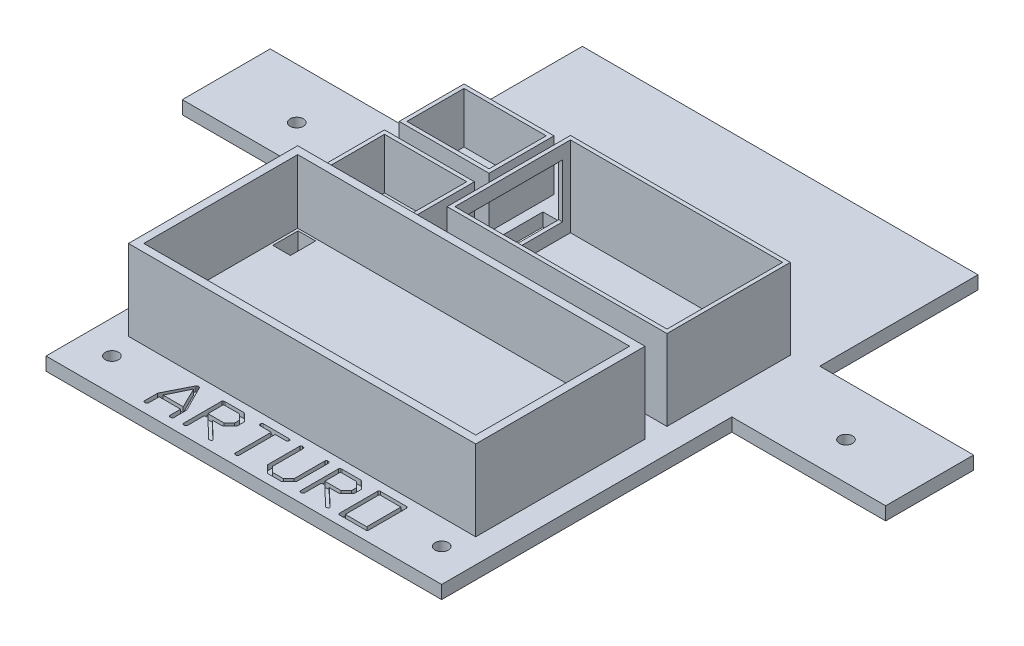
from build123d import *

# Parameters (mm, degrees)
SKETCH1_W           = 90
SKETCH1_H           = 145
BOSS_EXTRUDE1_DEPTH = 3
SKETCH3_W           = 35
SKETCH3_H           = 20
BOSS_EXTRUDE2_DEPTH = 3
SKETCH2_R           = 1.5
CUT_EXTRUDE1_DEPTH  = 3
SKETCH5_W           = 79
SKETCH5_H           = 38.5
BOSS_EXTRUDE3_DEPTH = 18.3
SKETCH7_W           = 75.5
SKETCH7_H           = 35
CUT_EXTRUDE3_DEPTH  = 14.5
SKETCH14_W          = 4
SKETCH14_H          = 5.732043078
CUT_EXTRUDE6_DEPTH  = 192.990234127
SKETCH8_W           = 20.45
SKETCH8_H           = 14.75
BOSS_EXTRUDE4_DEPTH = 11.55
SKETCH11_W          = 9.7
SKETCH11_H          = 8.5
CUT_EXTRUDE4_DEPTH  = 192.994016834
SKETCH12_W          = 9.7
SKETCH12_H          = 8.5
BOSS_EXTRUDE5_DEPTH = 11.55
SKETCH13_W          = 18.7
SKETCH13_H          = 13
CUT_EXTRUDE5_DEPTH  = 11.55
SKETCH19_W          = 50
SKETCH19_H          = 28.05
BOSS_EXTRUDE6_DEPTH = 18.3
SKETCH20_W          = 48.25
SKETCH20_H          = 26.3
CUT_EXTRUDE7_DEPTH  = 18.3
SKETCH22_W          = 22.713702628
SKETCH22_H          = 12.207325078
CUT_EXTRUDE8_DEPTH  = 1.75
SKETCH23_W          = 4.71681506
SKETCH23_H          = 27.232452361
CUT_EXTRUDE9_DEPTH  = 193.314560031
SKETCH24_W          = 4.877009242
SKETCH24_H          = 7.75887834
CUT_EXTRUDE10_DEPTH = 1.2
SKETCH25_R          = 1.5
CUT_EXTRUDE11_DEPTH = 193.314560172
SKETCH26_W          = 90
SKETCH26_H          = 23
CUT_EXTRUDE12_DEPTH = 193.314560172


with BuildPart() as part:
    # Sketch1 → Boss-Extrude1 (new body)
    with BuildSketch(Plane(origin=(0, 0, 0), x_dir=(1, 0, 0), z_dir=(0, 1, 0))):
        with Locations((45, 72.5)):
            Rectangle(SKETCH1_W, SKETCH1_H)
    extrude(amount=BOSS_EXTRUDE1_DEPTH)

    # Sketch3 → Boss-Extrude2 (add)
    with BuildSketch(Plane(origin=(0, 3, 0), x_dir=(1, 0, 0), z_dir=(0, 1, 0))):
        with Locations((107.5, 76)):
            Rectangle(SKETCH3_W, SKETCH3_H)
        with Locations((-17.5, 76)):
            Rectangle(SKETCH3_W, SKETCH3_H)
    extrude(amount=-BOSS_EXTRUDE2_DEPTH)

    # Sketch2 → Cut-Extrude1 (cut)
    with BuildSketch(Plane(origin=(0, 3, 0), x_dir=(1, 0, 0), z_dir=(0, 1, 0))):
        with Locations((7.5, 7.5)):
            Circle(SKETCH2_R)
        with Locations((82.5, 7.5)):
            Circle(SKETCH2_R)
    extrude(amount=-CUT_EXTRUDE1_DEPTH, mode=Mode.SUBTRACT)

    # Sketch5 → Boss-Extrude3 (add)
    with BuildSketch(Plane(origin=(0, 3, 0), x_dir=(1, 0, 0), z_dir=(0, 1, 0))):
        with Locations((45, 32.5)):
            Rectangle(SKETCH5_W, SKETCH5_H)
    extrude(amount=BOSS_EXTRUDE3_DEPTH)

    # Sketch7 → Cut-Extrude3 (cut)
    with BuildSketch(Plane(origin=(0, 21.3, 0), x_dir=(1, 0, 0), z_dir=(0, 1, 0))):
        with Locations((45, 32.5)):
            Rectangle(SKETCH7_W, SKETCH7_H)
    extrude(amount=-CUT_EXTRUDE3_DEPTH, mode=Mode.SUBTRACT)

    # Sketch14 → Cut-Extrude6 (cut, through all)
    with BuildSketch(Plane(origin=(0, 6.8, 0), x_dir=(1, 0, 0), z_dir=(0, 1, 0))):
        with Locations((9.802648825, 46.664015238)):
            Rectangle(SKETCH14_W, SKETCH14_H)
    extrude(amount=-CUT_EXTRUDE6_DEPTH, mode=Mode.SUBTRACT)

    # Sketch8 → Boss-Extrude4 (add)
    with BuildSketch(Plane(origin=(0, 3, 0), x_dir=(1, 0, 0), z_dir=(0, 1, 0))):
        with Locations((15.725, 64.125)):
            Rectangle(SKETCH8_W, SKETCH8_H)
        with Locations((15.725, 82.214128063)):
            Rectangle(SKETCH8_W, SKETCH8_H)
    extrude(amount=BOSS_EXTRUDE4_DEPTH)

    # Sketch11 → Cut-Extrude4 (cut, through all)
    with BuildSketch(Plane(origin=(0, 14.55, 0), x_dir=(1, 0, 0), z_dir=(0, 1, 0))):
        with Locations((19.625, 64.125)):
            Rectangle(SKETCH11_W, SKETCH11_H)
        with Locations((19.625, 82.214128063)):
            Rectangle(SKETCH11_W, SKETCH11_H)
    extrude(amount=-CUT_EXTRUDE4_DEPTH, mode=Mode.SUBTRACT)

    # Sketch12 → Boss-Extrude5 (add)
    with BuildSketch(Plane(origin=(0, 14.55, 0), x_dir=(1, 0, 0), z_dir=(0, 1, 0))):
        with Locations((19.625, 64.125)):
            Rectangle(SKETCH12_W, SKETCH12_H)
    extrude(amount=-BOSS_EXTRUDE5_DEPTH)

    # Sketch13 → Cut-Extrude5 (cut)
    with BuildSketch(Plane(origin=(0, 14.55, 0), x_dir=(1, 0, 0), z_dir=(0, 1, 0))):
        with Locations((15.725, 64.125)):
            Rectangle(SKETCH13_W, SKETCH13_H)
        with Locations((15.725, 82.214128063)):
            Rectangle(SKETCH13_W, SKETCH13_H)
    extrude(amount=-CUT_EXTRUDE5_DEPTH, mode=Mode.SUBTRACT)

    # Sketch19 → Boss-Extrude6 (add)
    with BuildSketch(Plane(origin=(0, 3, 0), x_dir=(1, 0, 0), z_dir=(0, 1, 0))):
        with Locations((59.5, 70.775)):
            Rectangle(SKETCH19_W, SKETCH19_H)
    extrude(amount=BOSS_EXTRUDE6_DEPTH)

    # Sketch20 → Cut-Extrude7 (cut)
    with BuildSketch(Plane(origin=(0, 21.3, 0), x_dir=(1, 0, 0), z_dir=(0, 1, 0))):
        with Locations((59.5, 70.775)):
            Rectangle(SKETCH20_W, SKETCH20_H)
    extrude(amount=-CUT_EXTRUDE7_DEPTH, mode=Mode.SUBTRACT)

    # Sketch22 → Cut-Extrude8 (cut)
    with BuildSketch(Plane.ZY.offset(-34.5)):
        with Locations((-70.775, 12.15)):
            Rectangle(SKETCH22_W, SKETCH22_H)
    extrude(amount=-CUT_EXTRUDE8_DEPTH, mode=Mode.SUBTRACT)

    # Sketch23 → Cut-Extrude9 (cut, through all)
    with BuildSketch(Plane(origin=(0, 3, 0), x_dir=(1, 0, 0), z_dir=(0, 1, 0))):
        with Locations((30.482199325, 71.298665432)):
            Rectangle(SKETCH23_W, SKETCH23_H)
    extrude(amount=-CUT_EXTRUDE9_DEPTH, mode=Mode.SUBTRACT)

    # Sketch24 → Cut-Extrude10 (cut)
    # profile 1 of 6: a face of its own
    with BuildSketch(Plane(origin=(0, 3, 0), x_dir=(1, 0, 0), z_dir=(0, 1, 0))):
        with BuildLine():
            Line((23.730328164, 11.141392021), (26.669349714, 5.334356513))
            Line((26.669349714, 5.334356513), (26.669349714, 2.386675501))
            add(Edge.make_bspline(
                [(26.669349714, 2.386675501), (26.662682685, 2.361570352), (26.649710289, 2.312721918), (26.616613779, 2.245534151), (26.570492881, 2.188690014), (26.511775677, 2.142919434), (26.440991913, 2.108059033), (26.35819529, 2.084804313), (26.264698822, 2.068766445), (26.198350998, 2.067131048), (26.163637108, 2.066275391)],
                knots=[0, 0, 0, 0, 0.947643866, 1.843881502, 2.713660738, 3.599912128, 4.543320166, 5.577847846, 6.732704141, 8, 8, 8, 8], degree=3))
            add(Edge.make_bspline(
                [(26.163637108, 2.066275391), (26.113937517, 2.070048438), (26.018408571, 2.077300715), (25.908602927, 2.129648138), (25.840486046, 2.195243361), (25.806488008, 2.264136158), (25.785617602, 2.347918769), (25.783672681, 2.409038929), (25.782620761, 2.44209606)],
                knots=[0, 0, 0, 0, 1.458306385, 2.803050631, 3.475744591, 4.205244022, 5.029297625, 6, 6, 6, 6], degree=3))
            Line((25.782620761, 2.44209606), (25.782620761, 4.837303369))
            Line((25.782620761, 4.837303369), (20.905611519, 4.837303369))
            Line((20.905611519, 4.837303369), (20.902147734, 2.357233328))
            add(Edge.make_bspline(
                [(20.902147734, 2.357233328), (20.894029138, 2.330923303), (20.877227743, 2.27647483), (20.816108463, 2.20872706), (20.737084205, 2.146464259), (20.672087968, 2.116832927), (20.637168183, 2.10091324)],
                knots=[0, 0, 0, 0, 0.85446616, 1.768313713, 2.801007444, 4, 4, 4, 4], degree=3))
            add(Edge.make_bspline(
                [(20.637168183, 2.10091324), (20.626394863, 2.095157835), (20.600446211, 2.081295347), (20.548952643, 2.074064899), (20.483311368, 2.066233222), (20.434018269, 2.066260399), (20.406826482, 2.066275391)],
                knots=[0, 0, 0, 0, 0.618990669, 1.490902888, 2.615894787, 4, 4, 4, 4], degree=3))
            add(Edge.make_bspline(
                [(20.406826482, 2.066275391), (20.379610123, 2.067160484), (20.327571154, 2.068852824), (20.253252524, 2.084813996), (20.186513326, 2.11108231), (20.12614444, 2.147142466), (20.075288668, 2.198297818), (20.042795851, 2.268509585), (20.021826278, 2.35311501), (20.019915072, 2.415383698), (20.018882565, 2.44902363)],
                knots=[0, 0, 0, 0, 1.042871789, 1.994020302, 2.898665572, 3.783582711, 4.676223712, 5.617005175, 6.71261484, 8, 8, 8, 8], degree=3))
            Line((20.018882565, 2.44902363), (20.018882565, 2.584111244))
            Line((20.018882565, 2.584111244), (20.018882565, 5.386313288))
            Line((20.018882565, 5.386313288), (22.952708438, 11.196812581))
            add(Edge.make_bspline(
                [(22.952708438, 11.196812581), (22.967632555, 11.215351287), (22.999113493, 11.254456842), (23.063987108, 11.303565216), (23.146261095, 11.343932556), (23.207610891, 11.365481602), (23.240202591, 11.376929399)],
                knots=[0, 0, 0, 0, 0.825089278, 1.740443647, 2.79962467, 4, 4, 4, 4], degree=3))
            add(Edge.make_bspline(
                [(23.240202591, 11.376929399), (23.298381001, 11.375163174), (23.40589449, 11.371899197), (23.549925192, 11.326436773), (23.666567863, 11.252879719), (23.709209409, 11.178319097), (23.730328164, 11.141392021)],
                knots=[0, 0, 0, 0, 1.208227024, 2.232799106, 3.124771774, 4, 4, 4, 4], degree=3))
        make_face()
        Polygon((21.03203967, 5.613191203), (25.595576373, 5.613191203), (23.300818828, 10.294496595), align=None, mode=Mode.SUBTRACT)
    # profile 2 of 6: a face of its own
    with BuildSketch(Plane(origin=(0, 3, 0), x_dir=(1, 0, 0), z_dir=(0, 1, 0))):
        with BuildLine():
            Line((33.986595471, 11.214131505), (35.507197074, 9.683138547))
            Line((35.507197074, 9.683138547), (35.536639246, 9.544587148))
            Line((35.536639246, 9.544587148), (35.531443569, 8.022253652))
            Line((35.531443569, 8.022253652), (35.505465181, 7.935659028))
            Line((35.505465181, 7.935659028), (33.880950029, 6.350977403))
            Line((33.880950029, 6.350977403), (33.662731576, 6.278237918))
            Line((33.662731576, 6.278237918), (31.548090849, 6.278237918))
            Line((31.548090849, 6.278237918), (35.489878149, 2.552937179))
            add(Edge.make_bspline(
                [(35.489878149, 2.552937179), (35.500842466, 2.521355255), (35.518470382, 2.470579315), (35.5316552, 2.418489447), (35.536639246, 2.398798748)],
                knots=[0, 0, 0, 0, 1.243971999, 2, 2, 2, 2], degree=3))
            add(Edge.make_bspline(
                [(35.536639246, 2.398798748), (35.536639246, 2.395767936), (35.536639246, 2.391726854), (35.536639246, 2.394613341), (35.536639246, 2.395334963)],
                knots=[0, 0, 0, 0, 1.5, 2, 2, 2, 2], degree=3))
            add(Edge.make_bspline(
                [(35.536639246, 2.395334963), (35.541470683, 2.382268041), (35.550522307, 2.357787359), (35.551570575, 2.319408504), (35.536408725, 2.285535769), (35.518312338, 2.270022968), (35.508928966, 2.261979242)],
                knots=[0, 0, 0, 0, 1.11883269, 2.096116091, 3.012794686, 4, 4, 4, 4], degree=3))
            add(Edge.make_bspline(
                [(35.508928966, 2.261979242), (35.497321643, 2.242012495), (35.471773608, 2.19806514), (35.402740851, 2.147026434), (35.310183957, 2.102488872), (35.238569104, 2.079180083), (35.198920211, 2.066275391)],
                knots=[0, 0, 0, 0, 0.72925176, 1.605103046, 2.67408771, 4, 4, 4, 4], degree=3))
            add(Edge.make_bspline(
                [(35.198920211, 2.066275391), (35.157853454, 2.066542944), (35.083009162, 2.06703056), (34.98244488, 2.07969479), (34.902735717, 2.09525937), (34.861475892, 2.117435488), (34.843882251, 2.126891628)],
                knots=[0, 0, 0, 0, 1.351550787, 2.463205539, 3.344694023, 4, 4, 4, 4], degree=3))
            Line((34.843882251, 2.126891628), (30.576499164, 6.278237918))
            Line((30.576499164, 6.278237918), (29.77290105, 6.278237918))
            Line((29.77290105, 6.278237918), (29.771169158, 2.362429006))
            add(Edge.make_bspline(
                [(29.771169158, 2.362429006), (29.76505415, 2.340375817), (29.751608956, 2.291887018), (29.695303681, 2.227483392), (29.615668277, 2.163478279), (29.550719795, 2.125404812), (29.51484907, 2.104377025)],
                knots=[0, 0, 0, 0, 0.725058933, 1.594202014, 2.671289696, 4, 4, 4, 4], degree=3))
            add(Edge.make_bspline(
                [(29.51484907, 2.104377025), (29.502372432, 2.097921784), (29.47410045, 2.083294247), (29.419602833, 2.076219806), (29.352469834, 2.065510073), (29.301911185, 2.066003903), (29.274116014, 2.066275391)],
                knots=[0, 0, 0, 0, 0.680304615, 1.541565885, 2.648448938, 4, 4, 4, 4], degree=3))
            add(Edge.make_bspline(
                [(29.274116014, 2.066275391), (29.246899655, 2.067160484), (29.194860686, 2.068852824), (29.120542056, 2.084813996), (29.053802858, 2.11108231), (28.993433971, 2.147142466), (28.9425782, 2.198297818), (28.910085383, 2.268509585), (28.88911581, 2.35311501), (28.887204604, 2.415383698), (28.886172097, 2.44902363)],
                knots=[0, 0, 0, 0, 1.042871789, 1.994020302, 2.898665572, 3.783582711, 4.676223712, 5.617005175, 6.71261484, 8, 8, 8, 8], degree=3))
            Line((28.886172097, 2.44902363), (28.886172097, 11.101558494))
            add(Edge.make_bspline(
                [(28.886172097, 11.101558494), (28.89749399, 11.131141258), (28.919469228, 11.188559953), (28.974951556, 11.261398494), (29.046759502, 11.3183269), (29.104146941, 11.338687068), (29.133832723, 11.349219119)],
                knots=[0, 0, 0, 0, 1.036233373, 2.011278177, 2.971259878, 4, 4, 4, 4], degree=3))
            Line((29.133832723, 11.349219119), (29.461160403, 11.364806152))
            Line((29.461160403, 11.364806152), (33.574405059, 11.376929399))
            add(Edge.make_bspline(
                [(33.574405059, 11.376929399), (33.617903391, 11.375073983), (33.699685152, 11.371585592), (33.814610887, 11.341942577), (33.912799817, 11.290449599), (33.962334207, 11.239222053), (33.986595471, 11.214131505)],
                knots=[0, 0, 0, 0, 1.138914518, 2.141287496, 3.08962818, 4, 4, 4, 4], degree=3))
        make_face()
        Polygon((34.649910293, 9.390448717), (33.437585552, 10.601041565), (29.77290105, 10.601041565), (29.77290105, 7.054125752), (33.427194197, 7.054125752), (34.649910293, 8.275109956), align=None, mode=Mode.SUBTRACT)
    # profile 3 of 6: a face of its own
    with BuildSketch(Plane(origin=(0, 3, 0), x_dir=(1, 0, 0), z_dir=(0, 1, 0))):
        with BuildLine():
            add(Edge.make_bspline(
                [(43.967491871, 11.361342367), (44.018570044, 11.350739143), (44.11287575, 11.331162396), (44.233609573, 11.264956365), (44.316309284, 11.166793086), (44.334226722, 11.087884081), (44.343312541, 11.047869827)],
                knots=[0, 0, 0, 0, 1.181692692, 2.181760989, 3.077982587, 4, 4, 4, 4], degree=3))
            add(Edge.make_bspline(
                [(44.343312541, 11.047869827), (44.342780911, 11.01999841), (44.341723776, 10.964576748), (44.31876393, 10.884249589), (44.286410981, 10.806763865), (44.237409118, 10.733506329), (44.163271449, 10.668750994), (44.054003696, 10.629783495), (43.916183391, 10.604537876), (43.812943221, 10.602281629), (43.756200988, 10.601041565)],
                knots=[0, 0, 0, 0, 0.786245999, 1.56343179, 2.346953672, 3.158622924, 4.039912103, 5.081205552, 6.395789976, 8, 8, 8, 8], degree=3))
            Line((43.756200988, 10.601041565), (41.52205968, 10.601041565))
            Line((41.52205968, 10.601041565), (41.52205968, 2.357233328))
            add(Edge.make_bspline(
                [(41.52205968, 2.357233328), (41.507590407, 2.318478379), (41.478494871, 2.240547994), (41.377759647, 2.151939503), (41.243548, 2.091651877), (41.140028893, 2.075198172), (41.083890881, 2.066275391)],
                knots=[0, 0, 0, 0, 0.875438603, 1.760375598, 2.785460327, 4, 4, 4, 4], degree=3))
            add(Edge.make_bspline(
                [(41.083890881, 2.066275391), (41.052098281, 2.067335269), (40.991648945, 2.069350484), (40.905193139, 2.082755841), (40.828288906, 2.107439433), (40.758552339, 2.14046189), (40.701922223, 2.193726214), (40.661228882, 2.265762918), (40.64027975, 2.357273965), (40.637069583, 2.423527383), (40.635330727, 2.459414985)],
                knots=[0, 0, 0, 0, 1.106735935, 2.104308933, 3.032056499, 3.912699536, 4.765629981, 5.692724586, 6.750214194, 8, 8, 8, 8], degree=3))
            Line((40.635330727, 2.459414985), (40.635330727, 10.601041565))
            Line((40.635330727, 10.601041565), (38.075593632, 10.601041565))
            add(Edge.make_bspline(
                [(38.075593632, 10.601041565), (38.046875526, 10.603245539), (37.989095583, 10.607679868), (37.90817589, 10.648861099), (37.839142643, 10.716615467), (37.803633531, 10.773329982), (37.784635694, 10.803672986)],
                knots=[0, 0, 0, 0, 0.920024065, 1.85106007, 2.850289155, 4, 4, 4, 4], degree=3))
            add(Edge.make_bspline(
                [(37.784635694, 10.803672986), (37.776054108, 10.836398268), (37.760680644, 10.895023905), (37.755673671, 10.955389054), (37.753461629, 10.982057912)],
                knots=[0, 0, 0, 0, 1.116415417, 2, 2, 2, 2], degree=3))
            add(Edge.make_bspline(
                [(37.753461629, 10.982057912), (37.754292955, 11.008723836), (37.755881279, 11.059671517), (37.772353601, 11.131226542), (37.79555903, 11.195810629), (37.833269897, 11.249622692), (37.878994251, 11.296273066), (37.935537563, 11.332266958), (38.001412977, 11.361210113), (38.049915023, 11.371487961), (38.075593632, 11.376929399)],
                knots=[0, 0, 0, 0, 1.135223372, 2.16894787, 3.120179468, 4.042274884, 4.947778528, 5.890363842, 6.883087883, 8, 8, 8, 8], degree=3))
            Line((38.075593632, 11.376929399), (43.967491871, 11.361342367))
        make_face()
    # profile 4 of 6: a face of its own
    with BuildSketch(Plane(origin=(0, 3, 0), x_dir=(1, 0, 0), z_dir=(0, 1, 0))):
        with BuildLine():
            add(Edge.make_bspline(
                [(47.3723925, 11.260892603), (47.39315623, 11.239853194), (47.43559793, 11.196847997), (47.479953616, 11.111526548), (47.50258433, 11.009218301), (47.505784935, 10.935983491), (47.507480114, 10.89719518)],
                knots=[0, 0, 0, 0, 0.882650724, 1.804165135, 2.836991241, 4, 4, 4, 4], degree=3))
            Line((47.507480114, 10.89719518), (47.507480114, 4.009458761))
            Line((47.507480114, 4.009458761), (48.68170322, 2.842163225))
            Line((48.68170322, 2.842163225), (51.173896508, 2.842163225))
            Line((51.173896508, 2.842163225), (52.384489357, 4.056219858))
            Line((52.384489357, 4.056219858), (52.384489357, 11.120609311))
            add(Edge.make_bspline(
                [(52.384489357, 11.120609311), (52.402646433, 11.154493895), (52.437444294, 11.219433372), (52.512524911, 11.299149559), (52.605923929, 11.353682804), (52.675944792, 11.367909207), (52.711817037, 11.375197507)],
                knots=[0, 0, 0, 0, 1.060672957, 2.032769508, 2.992172196, 4, 4, 4, 4], degree=3))
            add(Edge.make_bspline(
                [(52.711817037, 11.375197507), (52.751690725, 11.373768041), (52.827323586, 11.371056615), (52.936292628, 11.353367994), (53.031308435, 11.315522954), (53.117415393, 11.26833514), (53.186490693, 11.200229735), (53.239181651, 11.11478641), (53.265042564, 11.008860376), (53.269075907, 10.93367032), (53.27121831, 10.893731395)],
                knots=[0, 0, 0, 0, 1.13662016, 2.155953935, 3.124124809, 4.037977889, 4.933445915, 5.855694631, 6.861002965, 8, 8, 8, 8], degree=3))
            Line((53.27121831, 10.893731395), (53.220993428, 3.683862973))
            Line((53.220993428, 3.683862973), (51.591282598, 2.088789993))
            Line((51.591282598, 2.088789993), (51.352281435, 2.066275391))
            Line((51.352281435, 2.066275391), (48.309346335, 2.066275391))
            Line((48.309346335, 2.066275391), (48.196773324, 2.14247866))
            Line((48.196773324, 2.14247866), (46.653657118, 3.689058651))
            Line((46.653657118, 3.689058651), (46.620751161, 3.851856545))
            Line((46.620751161, 3.851856545), (46.620751161, 11.113681741))
            add(Edge.make_bspline(
                [(46.620751161, 11.113681741), (46.635543558, 11.14885751), (46.664033695, 11.21660599), (46.738698041, 11.298941692), (46.836810345, 11.352058548), (46.909965882, 11.367271686), (46.948078841, 11.375197507)],
                knots=[0, 0, 0, 0, 1.028909836, 1.981678895, 2.948484413, 4, 4, 4, 4], degree=3))
            add(Edge.make_bspline(
                [(46.948078841, 11.375197507), (46.993198955, 11.374016338), (47.077641144, 11.371805782), (47.194754368, 11.352078243), (47.293869225, 11.316386596), (47.34706, 11.278795595), (47.3723925, 11.260892603)],
                knots=[0, 0, 0, 0, 1.208192095, 2.261128696, 3.171849697, 4, 4, 4, 4], degree=3))
        make_face()
    # profile 5 of 6: a face of its own
    with BuildSketch(Plane(origin=(0, 3, 0), x_dir=(1, 0, 0), z_dir=(0, 1, 0))):
        with BuildLine():
            Line((60.588464066, 11.214131505), (62.109065669, 9.683138547))
            Line((62.109065669, 9.683138547), (62.138507842, 9.544587148))
            Line((62.138507842, 9.544587148), (62.133312164, 8.022253652))
            Line((62.133312164, 8.022253652), (62.107333777, 7.935659028))
            Line((62.107333777, 7.935659028), (60.482818624, 6.350977403))
            Line((60.482818624, 6.350977403), (60.264600171, 6.278237918))
            Line((60.264600171, 6.278237918), (58.149959445, 6.278237918))
            Line((58.149959445, 6.278237918), (62.091746745, 2.552937179))
            add(Edge.make_bspline(
                [(62.091746745, 2.552937179), (62.102711061, 2.521355255), (62.120338977, 2.470579315), (62.133523796, 2.418489447), (62.138507842, 2.398798748)],
                knots=[0, 0, 0, 0, 1.243971999, 2, 2, 2, 2], degree=3))
            add(Edge.make_bspline(
                [(62.138507842, 2.398798748), (62.138507842, 2.395767936), (62.138507842, 2.391726854), (62.138507842, 2.394613341), (62.138507842, 2.395334963)],
                knots=[0, 0, 0, 0, 1.5, 2, 2, 2, 2], degree=3))
            add(Edge.make_bspline(
                [(62.138507842, 2.395334963), (62.143339279, 2.382268041), (62.152390903, 2.357787359), (62.15343917, 2.319408504), (62.138277321, 2.285535769), (62.120180933, 2.270022968), (62.110797562, 2.261979242)],
                knots=[0, 0, 0, 0, 1.11883269, 2.096116091, 3.012794686, 4, 4, 4, 4], degree=3))
            add(Edge.make_bspline(
                [(62.110797562, 2.261979242), (62.099190239, 2.242012495), (62.073642204, 2.19806514), (62.004609446, 2.147026434), (61.912052553, 2.102488872), (61.8404377, 2.079180083), (61.800788807, 2.066275391)],
                knots=[0, 0, 0, 0, 0.72925176, 1.605103046, 2.67408771, 4, 4, 4, 4], degree=3))
            add(Edge.make_bspline(
                [(61.800788807, 2.066275391), (61.75972205, 2.066542944), (61.684877757, 2.06703056), (61.584313475, 2.07969479), (61.504604312, 2.09525937), (61.463344488, 2.117435488), (61.445750847, 2.126891628)],
                knots=[0, 0, 0, 0, 1.351550787, 2.463205539, 3.344694023, 4, 4, 4, 4], degree=3))
            Line((61.445750847, 2.126891628), (57.17836776, 6.278237918))
            Line((57.17836776, 6.278237918), (56.374769646, 6.278237918))
            Line((56.374769646, 6.278237918), (56.373037753, 2.362429006))
            add(Edge.make_bspline(
                [(56.373037753, 2.362429006), (56.366922746, 2.340375817), (56.353477552, 2.291887018), (56.297172277, 2.227483392), (56.217536873, 2.163478279), (56.15258839, 2.125404812), (56.116717665, 2.104377025)],
                knots=[0, 0, 0, 0, 0.725058933, 1.594202014, 2.671289696, 4, 4, 4, 4], degree=3))
            add(Edge.make_bspline(
                [(56.116717665, 2.104377025), (56.104241027, 2.097921784), (56.075969046, 2.083294247), (56.021471428, 2.076219806), (55.95433843, 2.065510073), (55.90377978, 2.066003903), (55.87598461, 2.066275391)],
                knots=[0, 0, 0, 0, 0.680304615, 1.541565885, 2.648448938, 4, 4, 4, 4], degree=3))
            add(Edge.make_bspline(
                [(55.87598461, 2.066275391), (55.848768251, 2.067160484), (55.796729282, 2.068852824), (55.722410651, 2.084813996), (55.655671454, 2.11108231), (55.595302567, 2.147142466), (55.544446796, 2.198297818), (55.511953978, 2.268509585), (55.490984406, 2.35311501), (55.4890732, 2.415383698), (55.488040693, 2.44902363)],
                knots=[0, 0, 0, 0, 1.042871789, 1.994020302, 2.898665572, 3.783582711, 4.676223712, 5.617005175, 6.71261484, 8, 8, 8, 8], degree=3))
            Line((55.488040693, 2.44902363), (55.488040693, 11.101558494))
            add(Edge.make_bspline(
                [(55.488040693, 11.101558494), (55.499362585, 11.131141258), (55.521337823, 11.188559953), (55.576820152, 11.261398494), (55.648628097, 11.3183269), (55.706015537, 11.338687068), (55.735701318, 11.349219119)],
                knots=[0, 0, 0, 0, 1.036233373, 2.011278177, 2.971259878, 4, 4, 4, 4], degree=3))
            Line((55.735701318, 11.349219119), (56.063028998, 11.364806152))
            Line((56.063028998, 11.364806152), (60.176273654, 11.376929399))
            add(Edge.make_bspline(
                [(60.176273654, 11.376929399), (60.219771986, 11.375073983), (60.301553747, 11.371585592), (60.416479482, 11.341942577), (60.514668413, 11.290449599), (60.564202803, 11.239222053), (60.588464066, 11.214131505)],
                knots=[0, 0, 0, 0, 1.138914518, 2.141287496, 3.08962818, 4, 4, 4, 4], degree=3))
        make_face()
        Polygon((61.251778888, 9.390448717), (60.039454148, 10.601041565), (56.374769646, 10.601041565), (56.374769646, 7.054125752), (60.029062793, 7.054125752), (61.251778888, 8.275109956), align=None, mode=Mode.SUBTRACT)
    # profile 6 of 6: a face of its own
    with BuildSketch(Plane(origin=(0, 3, 0), x_dir=(1, 0, 0), z_dir=(0, 1, 0))):
        with BuildLine():
            add(Edge.make_bspline(
                [(70.642099951, 11.363074259), (70.687710035, 11.35215688), (70.772586382, 11.3318406), (70.882850949, 11.277518431), (70.964981743, 11.201074937), (70.992239812, 11.136927699), (71.005797373, 11.105022279)],
                knots=[0, 0, 0, 0, 1.198848019, 2.230950549, 3.120113869, 4, 4, 4, 4], degree=3))
            Line((71.005797373, 11.105022279), (71.005797373, 10.895463288))
            Line((71.005797373, 10.895463288), (71.002333589, 2.362429006))
            add(Edge.make_bspline(
                [(71.002333589, 2.362429006), (70.994402249, 2.337541165), (70.977505609, 2.284521005), (70.92205618, 2.213689845), (70.844818815, 2.146277462), (70.781997112, 2.109074069), (70.747745393, 2.088789993)],
                knots=[0, 0, 0, 0, 0.810066725, 1.725736988, 2.760023768, 4, 4, 4, 4], degree=3))
            Line((70.747745393, 2.088789993), (70.583215607, 2.066275391))
            Line((70.583215607, 2.066275391), (64.604722743, 2.066275391))
            add(Edge.make_bspline(
                [(64.604722743, 2.066275391), (64.575148057, 2.080102473), (64.518691358, 2.106497729), (64.446807397, 2.164546531), (64.38926668, 2.234093026), (64.366691206, 2.289511009), (64.355330225, 2.317399801)],
                knots=[0, 0, 0, 0, 1.069880941, 2.042352972, 3.014825004, 4, 4, 4, 4], degree=3))
            Line((64.355330225, 2.317399801), (64.355330225, 2.584111244))
            Line((64.355330225, 2.584111244), (64.355330225, 11.113681741))
            add(Edge.make_bspline(
                [(64.355330225, 11.113681741), (64.36737595, 11.144210823), (64.391526027, 11.20541757), (64.462768256, 11.279963062), (64.555020362, 11.340378434), (64.628168625, 11.364239456), (64.667070872, 11.376929399)],
                knots=[0, 0, 0, 0, 0.917586887, 1.839639645, 2.85106129, 4, 4, 4, 4], degree=3))
            Line((64.667070872, 11.376929399), (70.642099951, 11.363074259))
        make_face()
        with Locations((67.680563799, 6.721602395)):
            Rectangle(SKETCH24_W, SKETCH24_H, mode=Mode.SUBTRACT)
    extrude(amount=-CUT_EXTRUDE10_DEPTH, mode=Mode.SUBTRACT)

    # Sketch25 → Cut-Extrude11 (cut, through all)
    with BuildSketch(Plane(origin=(0, 3, 0), x_dir=(1, 0, 0), z_dir=(0, 1, 0))):
        with Locations((-17.46875749, 74.5)):
            Circle(SKETCH25_R)
        with Locations((107.46875749, 74.5)):
            Circle(SKETCH25_R)
    extrude(amount=-CUT_EXTRUDE11_DEPTH, mode=Mode.SUBTRACT)

    # Sketch26 → Cut-Extrude12 (cut, through all)
    with BuildSketch(Plane(origin=(0, 3, 0), x_dir=(1, 0, 0), z_dir=(0, 1, 0))):
        with Locations((45, 133.5)):
            Rectangle(SKETCH26_W, SKETCH26_H)
    extrude(amount=-CUT_EXTRUDE12_DEPTH, mode=Mode.SUBTRACT)


solid = part.part
